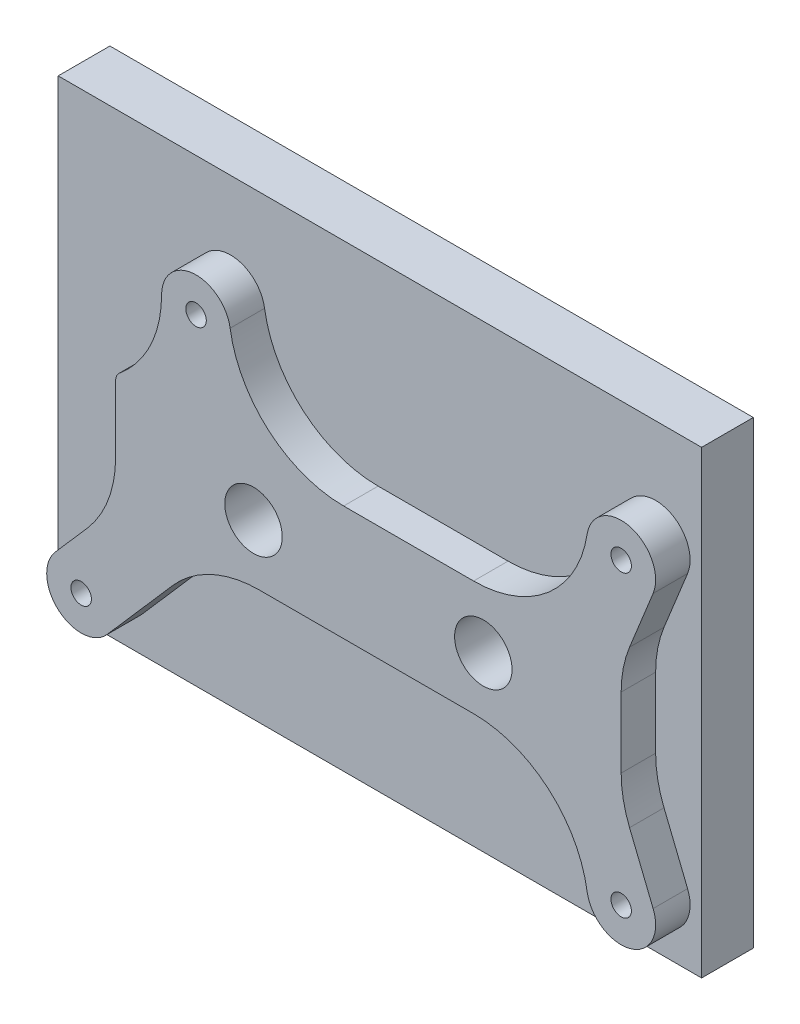
from build123d import *

# Parameters (mm, degrees)
SKETCH1_W               = 71.12
SKETCH1_H               = 50.8
BOSS_EXTRUDE1_DEPTH     = 5.715
SKETCH3_R               = 3.81
SKETCH3_W               = 55.88
SKETCH3_H               = 12.7
BOSS_EXTRUDE2_DEPTH     = 3.81
F_4_40_TAPPED_HOLE1_D   = 2.2606
BOSS_EXTRUDE4_DEPTH     = 3.81
FILLET1_R               = 12.7
FILLET2_R               = 1.27
CUT_EXTRUDE1_DEPTH      = 2.54
CUT_EXTRUDE1_DEPTH_BACK = 88.917120204
SKETCH9_R               = 3.175


with BuildPart() as part:
    # Sketch1 → Boss-Extrude1 (new body)
    with BuildSketch(Plane.XY):
        with Locations((35.56, 25.4)):
            Rectangle(SKETCH1_W, SKETCH1_H)
    extrude(amount=BOSS_EXTRUDE1_DEPTH)

    # Sketch3 → Boss-Extrude2 (add)
    with BuildSketch(Plane.XY.offset(5.715)):
        with Locations(Location((19.05, 39.37, 0), (0, 0, 180))):
            Circle(SKETCH3_R)
        with Locations(Location((66.04, 39.37, 0), (0, 0, 180))):
            Circle(SKETCH3_R)
        with Locations(Location((6.35, 6.35, 0), (0, 0, 180))):
            Circle(SKETCH3_R)
        with Locations(Location((66.04, 6.35, 0), (0, 0, 180))):
            Circle(SKETCH3_R)
        with Locations((38.1, 22.86)):
            Rectangle(SKETCH3_W, SKETCH3_H)
    extrude(amount=BOSS_EXTRUDE2_DEPTH)

    # #4-40 Tapped Hole1 (through all)
    with Locations(Plane(origin=(0, 0, 0), x_dir=(-1, 0, 0), z_dir=(0, 0, -1))):
        with Locations((-66.04, 6.35), (-66.04, 39.37), (-19.05, 39.37), (-6.35, 6.35)):
            Hole(F_4_40_TAPPED_HOLE1_D / 2)

    # Sketch7 → Boss-Extrude4 (add)
    with BuildSketch(Plane.XY.offset(5.715)):
        with BuildLine():
            Line((15.24, 39.37), (15.24, 29.21))
            Line((15.24, 29.21), (22.86, 29.21))
            Line((22.86, 29.21), (22.86, 39.37))
            ThreePointArc((22.86, 39.37), (19.05, 35.56), (15.24, 39.37))
        make_face()
        with BuildLine():
            Line((62.23, 39.37), (62.23, 29.21))
            Line((62.23, 29.21), (66.04, 29.21))
            Line((66.04, 29.21), (69.571964529, 37.94125))
            ThreePointArc((69.571964529, 37.94125), (65.31222423, 35.630154759), (62.23, 39.37))
        make_face()
        with BuildLine():
            Line((3.479452055, 8.855205479), (10.16, 16.51))
            Line((10.16, 16.51), (20.273818182, 16.51))
            Line((20.273818182, 16.51), (9.220547945, 3.844794521))
            ThreePointArc((9.220547945, 3.844794521), (8.855205479, 9.220547945), (3.479452055, 8.855205479))
        make_face()
        with BuildLine():
            Line((62.23, 6.35), (62.23, 16.51))
            Line((62.23, 16.51), (66.04, 16.51))
            Line((66.04, 16.51), (69.571964529, 7.77875))
            ThreePointArc((69.571964529, 7.77875), (65.31222423, 10.089845241), (62.23, 6.35))
        make_face()
    extrude(amount=BOSS_EXTRUDE4_DEPTH)

    # Fillet1
    # the kernel refuses this fillet: 12.7 mm, written as the material it adds along each edge
    with BuildSketch(Plane(origin=(10.16, 16.51, -6.19125), x_dir=(0, 1, 0), z_dir=(0, 0, 1))) as fillet1_piece_1_section:
        with BuildLine():
            CenterArc((FILLET1_R * 0.375, FILLET1_R), FILLET1_R, 228.887909561, 41.112090439)
            Line((-FILLET1_R * 0.282534246575, FILLET1_R * 0.246575342466), (0, 0))
            Line((0, 0), (FILLET1_R * 0.375, 0))
        make_face()
    fillet1_piece_1 = extrude(amount=15.71625, mode=Mode.PRIVATE)
    fillet1_piece_1 = split(fillet1_piece_1, bisect_by=Plane(origin=(9.519597121, 16.75015108, 0), z_dir=(0, 0, 1)), keep=Keep.TOP, mode=Mode.PRIVATE)
    add(fillet1_piece_1)
    with BuildSketch(Plane(origin=(15.24, 29.21, -19.685), x_dir=(0, 1, 0), z_dir=(0, 0, 1))) as fillet1_piece_2_section:
        with BuildLine():
            CenterArc((10.16, 12.7), FILLET1_R, 216.869897646, 53.130102354)
            Line((0, 5.08), (-1.016, 4.318))
            ThreePointArc((-1.016, 4.318), (-1.27, 2.54), (-1.27, 0))
            Line((-1.27, 0), (0, -1.27))
            Line((0, -1.27), (10.16, -1.27))
            Line((10.16, -1.27), (10.16, 0))
        make_face()
    fillet1_piece_2 = extrude(amount=29.21, mode=Mode.PRIVATE)
    fillet1_piece_2 = split(fillet1_piece_2, bisect_by=Plane(origin=(13.921943776, 33.679028112, 0), z_dir=(0, 0, 1)), keep=Keep.TOP, mode=Mode.PRIVATE)
    add(fillet1_piece_2)
    with BuildSketch(Plane(origin=(62.23, 29.21, -25.543613437), x_dir=(0.0042208920727075105, 0.9999910919953791, 0), z_dir=(0, 0, 1))) as fillet1_piece_3_section:
        with BuildLine():
            CenterArc((12.647111175, 12.556939323), FILLET1_R, 180.24184002, 81.150116902)
            Line((-0.052775693, 12.503333994), (-1.32276438, 12.497973461))
            Line((-1.32276438, 12.497973461), (-1.269988687, -0.005360533))
            Line((-1.269988687, -0.005360533), (0.005360533, -1.269988687))
            ThreePointArc((0.005360533, -1.269988687), (10.165270028, -1.227104423), (10.556163414, -1.255693932))
            Line((10.556163414, -1.255693932), (10.746249574, 0))
        make_face()
    fillet1_piece_3 = extrude(amount=35.068613437, mode=Mode.PRIVATE)
    fillet1_piece_3 = split(fillet1_piece_3, bisect_by=Plane(origin=(58.003710065, 32.244364844, 0), z_dir=(0, 0, 1)), keep=Keep.TOP, mode=Mode.PRIVATE)
    add(fillet1_piece_3)
    with BuildSketch(Plane(origin=(22.86, 29.21, -25.543613437), x_dir=(1, 0, 0), z_dir=(0, 0, 1))) as fillet1_piece_4_section:
        with BuildLine():
            CenterArc((12.503445375, 12.7), FILLET1_R, 188.849883098, 81.150116902)
            Line((-0.04535876, 10.746153846), (-1.300239173, 10.550769231))
            ThreePointArc((-1.300239173, 10.550769231), (-1.27, 10.16), (-1.27, 0))
            Line((-1.27, 0), (0, -1.27))
            Line((0, -1.27), (12.503445375, -1.27))
            Line((12.503445375, -1.27), (12.503445375, 0))
        make_face()
    fillet1_piece_4 = extrude(amount=35.068613437, mode=Mode.PRIVATE)
    fillet1_piece_4 = split(fillet1_piece_4, bisect_by=Plane(origin=(27.086289935, 32.244364844, 0), z_dir=(0, 0, 1)), keep=Keep.TOP, mode=Mode.PRIVATE)
    add(fillet1_piece_4)
    with BuildSketch(Plane(origin=(62.23, 16.51, -25.543613437), x_dir=(-1, 0, 0), z_dir=(0, 0, 1))) as fillet1_piece_5_section:
        with BuildLine():
            CenterArc((12.503445375, 12.7), FILLET1_R, 188.849883098, 81.150116902)
            Line((-0.04535876, 10.746153846), (-1.300239173, 10.550769231))
            ThreePointArc((-1.300239173, 10.550769231), (-1.27, 10.16), (-1.27, 0))
            Line((-1.27, 0), (0, -1.27))
            Line((0, -1.27), (12.503445375, -1.27))
            Line((12.503445375, -1.27), (12.503445375, 0))
        make_face()
    fillet1_piece_5 = extrude(amount=35.068613437, mode=Mode.PRIVATE)
    fillet1_piece_5 = split(fillet1_piece_5, bisect_by=Plane(origin=(58.003710065, 13.475635156, 0), z_dir=(0, 0, 1)), keep=Keep.TOP, mode=Mode.PRIVATE)
    add(fillet1_piece_5)
    with BuildSketch(Plane(origin=(20.273818182, 16.51, -8.716818182), x_dir=(-0.6575342465753422, -0.7534246575342469, 0), z_dir=(0, 0, 1))) as fillet1_piece_6_section:
        with BuildLine():
            CenterArc((FILLET1_R * 0.454545454545, FILLET1_R), FILLET1_R, 221.112090439, 48.887909561)
            Line((-FILLET1_R * 0.298879202989, FILLET1_R * 0.342465753425), (0, 0))
            Line((0, 0), (FILLET1_R * 0.454545454545, 0))
        make_face()
    fillet1_piece_6 = extrude(amount=18.241818182, mode=Mode.PRIVATE)
    fillet1_piece_6 = split(fillet1_piece_6, bisect_by=Plane(origin=(20.68190581, 15.612207219, 0), z_dir=(0, 0, 1)), keep=Keep.TOP, mode=Mode.PRIVATE)
    add(fillet1_piece_6)
    with BuildSketch(Plane(origin=(66.04, 29.21, -0.463566012), x_dir=(0, -1, 0), z_dir=(0, 0, 1))) as fillet1_piece_7_section:
        with BuildLine():
            CenterArc((FILLET1_R * 0.194600504301, FILLET1_R), FILLET1_R, 247.975687163, 22.024312837)
            Line((-FILLET1_R * 0.180399495699, FILLET1_R * 0.072975189113), (0, 0))
            Line((0, 0), (FILLET1_R * 0.194600504301, 0))
        make_face()
    fillet1_piece_7 = extrude(amount=9.988566012, mode=Mode.PRIVATE)
    fillet1_piece_7 = split(fillet1_piece_7, bisect_by=Plane(origin=(66.226537553, 29.173699698, 0), z_dir=(0, 0, 1)), keep=Keep.TOP, mode=Mode.PRIVATE)
    add(fillet1_piece_7)
    with BuildSketch(Plane(origin=(66.04, 16.51, -0.463566012), x_dir=(0.37499999999999534, -0.9270248108869598, 0), z_dir=(0, 0, 1))) as fillet1_piece_8_section:
        with BuildLine():
            CenterArc((FILLET1_R * 0.194600504301, FILLET1_R), FILLET1_R, 247.975687163, 22.024312837)
            Line((-FILLET1_R * 0.180399495699, FILLET1_R * 0.072975189113), (0, 0))
            Line((0, 0), (FILLET1_R * 0.194600504301, 0))
        make_face()
    fillet1_piece_8 = extrude(amount=9.988566012, mode=Mode.PRIVATE)
    fillet1_piece_8 = split(fillet1_piece_8, bisect_by=Plane(origin=(66.226537553, 16.546300302, 0), z_dir=(0, 0, 1)), keep=Keep.TOP, mode=Mode.PRIVATE)
    add(fillet1_piece_8)

    # Fillet2
    fillet2_edges = [part.edges().sort_by_distance(p)[0] for p in [
        (10.16, 29.21, 7.62),
    ]]
    fillet(fillet2_edges, radius=FILLET2_R)

    # Sketch9 → Cut-Extrude1 (cut, two sides: drawn at the far end of the back side and taken through both)
    with BuildSketch(Plane.XY.offset(9.525).offset(-CUT_EXTRUDE1_DEPTH_BACK)):
        with Locations((25.4, 22.86)):
            Circle(SKETCH9_R)
        with Locations((50.8, 22.86)):
            Circle(SKETCH9_R)
    extrude(amount=CUT_EXTRUDE1_DEPTH + CUT_EXTRUDE1_DEPTH_BACK, mode=Mode.SUBTRACT)


solid = part.part
